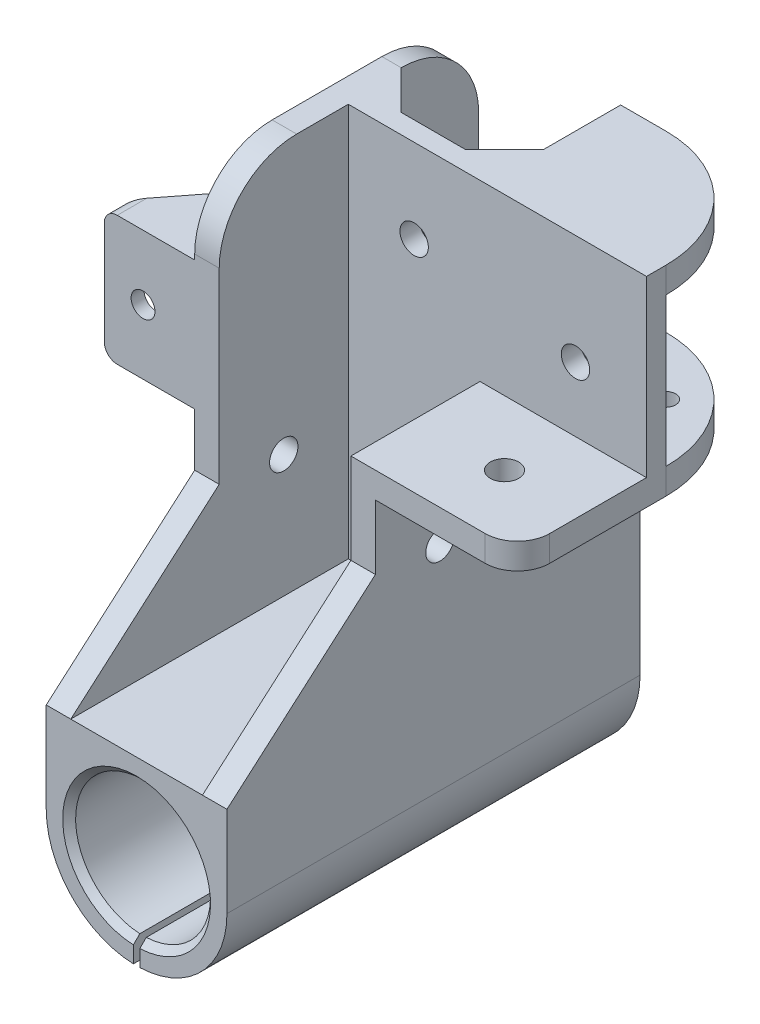
from build123d import *

# Parameters (mm, degrees)
BOSS_EXTRUDE1_DEPTH     = 64
CUT_EXTRUDE1_DEPTH      = 61
CUT_EXTRUDE2_DEPTH      = 103.493902258
CUT_EXTRUDE2_DEPTH_BACK = 103.493902258
CUT_EXTRUDE3_DEPTH      = 43
CUT_EXTRUDE4_DEPTH      = 105.961897849
CHAMFER1_SIZE           = 1
SKETCH6_R               = 2.2
CUT_EXTRUDE5_DEPTH      = 94.648278148
BOSS_EXTRUDE2_DEPTH     = 14
CUT_EXTRUDE6_DEPTH      = 106.81625079
SKETCH9_R               = 1.85
CUT_EXTRUDE7_DEPTH      = 93.746967605
FILLET1_R               = 2
FILLET2_R               = 12
SKETCH10_R              = 2.2
CUT_EXTRUDE8_DEPTH      = 108.168092266
FILLET3_R               = 5
FILLET4_START           = 44
FILLET4_DEPTH           = 31
SKETCH11_R              = 2.2
CUT_EXTRUDE9_DEPTH      = 97.098348533
SKETCH12_W              = 18
SKETCH12_H              = 23
CUT_EXTRUDE10_DEPTH     = 22
CUT_EXTRUDE11_REACH     = 95.568
SKETCH13_R              = 1.500000659
SKETCH13_R_2            = 1.499999352


with BuildPart() as part:
    # Sketch1 → Boss-Extrude1 (new body)
    with BuildSketch(Plane.XY):
        with BuildLine():
            Line((-14, 0), (-14, 75))
            Line((-14, 75), (36, 75))
            Line((36, 75), (36, 44))
            Line((36, 44), (14, 44))
            Line((14, 44), (14, 0))
            ThreePointArc((14, 0), (0, -14), (-14, 0))
        make_face()
    extrude(amount=BOSS_EXTRUDE1_DEPTH)

    # Sketch2 → Cut-Extrude1 (cut)
    with BuildSketch(Plane(origin=(0, 75, 0), x_dir=(1, 0, 0), z_dir=(0, 1, 0))):
        Polygon((-11, 0), (-11, -12), (-5, -18), (5, -18), (11, -12), (11, 0), align=None)
    extrude(amount=-CUT_EXTRUDE1_DEPTH, mode=Mode.SUBTRACT)

    # Sketch3 → Cut-Extrude2 (cut, two sides: drawn at the far end of the back side and taken through both)
    with BuildSketch(Plane(origin=(14, 0, 0), x_dir=(0, 0, -1), z_dir=(1, 0, 0)).offset(-CUT_EXTRUDE2_DEPTH_BACK)):
        Polygon((-64, 14), (-41, 34), (-41, 75), (-64, 75), align=None)
    extrude(amount=CUT_EXTRUDE2_DEPTH + CUT_EXTRUDE2_DEPTH_BACK, mode=Mode.SUBTRACT)

    # Sketch4 → Cut-Extrude3 (cut)
    with BuildSketch(Plane.XY.offset(64)):
        Polygon((-10.2, 14), (-10.2, 75), (36, 75), (36, 48), (10.2, 48), (10.2, 14), align=None)
    extrude(amount=-CUT_EXTRUDE3_DEPTH, mode=Mode.SUBTRACT)

    # Sketch5 → Cut-Extrude4 (cut, through all)
    with BuildSketch(Plane.XY.offset(64)):
        with BuildLine():
            Line((-0.5, -10.438031424), (-0.5, -13.99106858))
            ThreePointArc((-0.5, -13.99106858), (0, -14), (0.5, -13.99106858))
            Line((0.5, -13.99106858), (0.5, -10.438031424))
            ThreePointArc((0.5, -10.438031424), (0, 10.45), (-0.5, -10.438031424))
        make_face()
    extrude(amount=-CUT_EXTRUDE4_DEPTH, mode=Mode.SUBTRACT)

    # Chamfer1
    chamfer1_edges = [part.edges().sort_by_distance(p)[0] for p in [
        (0, 10.45, 0),
        (0, 10.45, 64),
    ]]
    chamfer(chamfer1_edges, length=CHAMFER1_SIZE)

    # Sketch6 → Cut-Extrude5 (cut, through all)
    with BuildSketch(Plane.XY.offset(21)):
        with Locations((0, 62)):
            Circle(SKETCH6_R)
        with Locations((0, 27)):
            Circle(SKETCH6_R)
        with Locations((25, 58)):
            Circle(SKETCH6_R)
    extrude(amount=-CUT_EXTRUDE5_DEPTH, mode=Mode.SUBTRACT)

    # Sketch7 → Boss-Extrude2 (add)
    with BuildSketch(Plane(origin=(-14, 0, 0), x_dir=(0, 0, -1), z_dir=(1, 0, 0))):
        Polygon((-41, 62.2), (-21, 62.2), (-21, 60.2), (-39, 60.2), (-39, 44.2), (-21, 44.2), (-21, 42.2), (-41, 42.2), align=None)
    extrude(amount=-BOSS_EXTRUDE2_DEPTH)

    # Sketch8 → Cut-Extrude6 (cut, through all)
    with BuildSketch(Plane(origin=(0, 62.2, 0), x_dir=(1, 0, 0), z_dir=(0, 1, 0))):
        Polygon((-14, -21), (-28, -39), (-28, -21), align=None)
    extrude(amount=-CUT_EXTRUDE6_DEPTH, mode=Mode.SUBTRACT)

    # Sketch9 → Cut-Extrude7 (cut, through all)
    with BuildSketch(Plane.XY.offset(41)):
        with Locations((-22, 52.2)):
            Circle(SKETCH9_R)
    extrude(amount=-CUT_EXTRUDE7_DEPTH, mode=Mode.SUBTRACT)

    # Fillet1
    fillet1_edges = [part.edges().sort_by_distance(p)[0] for p in [
        (-28, 42.2, 40),
        (-28, 62.2, 40),
    ]]
    fillet(fillet1_edges, radius=FILLET1_R)

    # Fillet2
    fillet2_edges = [part.edges().sort_by_distance(p)[0] for p in [
        (-12.5, 75, 0),
        (-12.1, 75, 41),
    ]]
    fillet(fillet2_edges, radius=FILLET2_R)

    # Sketch10 → Cut-Extrude8 (cut, through all)
    with BuildSketch(Plane(origin=(14, 0, 0), x_dir=(0, 0, -1), z_dir=(1, 0, 0))):
        with Locations(Location((-31, 33, 0), (0, 0, 90))):
            Circle(SKETCH10_R)
    extrude(amount=-CUT_EXTRUDE8_DEPTH, mode=Mode.SUBTRACT)

    # Fillet3
    fillet3_edges = [part.edges().sort_by_distance(p)[0] for p in [
        (36, 46, 41),
    ]]
    fillet(fillet3_edges, radius=FILLET3_R)

    # Fillet4: read off the stored shape, not the designer's step
    # Fillet4 outline → Fillet4 (cut)
    with BuildSketch(Plane(origin=(0, 0, 0), x_dir=(1, 0, 0), z_dir=(0, 1, 0)).offset(FILLET4_START)):
        with BuildLine():
            ThreePointArc((18, 0), (30.727922061, -5.272077939), (36, -18))
            Line((36, -18), (36, 0))
            Line((36, 0), (18, 0))
        make_face()
    extrude(amount=FILLET4_DEPTH, mode=Mode.SUBTRACT)

    # Sketch11 → Cut-Extrude9 (cut, through all)
    with BuildSketch(Plane(origin=(0, 48, 0), x_dir=(1, 0, 0), z_dir=(0, 1, 0))):
        with Locations(Location((24, -31, 0), (0, 0, 270))):
            Circle(SKETCH11_R)
    extrude(amount=-CUT_EXTRUDE9_DEPTH, mode=Mode.SUBTRACT)

    # Sketch12 → Cut-Extrude10 (cut)
    with BuildSketch(Plane.ZY.offset(-36)):
        with Locations((9, 59.5)):
            Rectangle(SKETCH12_W, SKETCH12_H)
    extrude(amount=CUT_EXTRUDE10_DEPTH, mode=Mode.SUBTRACT)

    # Sketch13 → Cut-Extrude11 (cut, up to next)
    with BuildSketch(Plane.XZ.offset(-44), mode=Mode.PRIVATE) as cut_extrude11_sk1:
        with Locations((19.000002521, 8.999996593)):
            Circle(SKETCH13_R)
    cut_extrude11_tool1 = extrude(cut_extrude11_sk1.sketch, amount=-CUT_EXTRUDE11_REACH, mode=Mode.PRIVATE) & part.part
    # Sketch13 → Cut-Extrude11 (cut, up to next)
    with BuildSketch(Plane.XZ.offset(-44), mode=Mode.PRIVATE) as cut_extrude11_sk2:
        with Locations((27.000001248, 8.999995496)):
            Circle(SKETCH13_R_2)
    cut_extrude11_tool2 = extrude(cut_extrude11_sk2.sketch, amount=-CUT_EXTRUDE11_REACH, mode=Mode.PRIVATE) & part.part
    add(cut_extrude11_tool1.solids().sort_by_distance((19.000003, 44, 8.999997))[0], mode=Mode.SUBTRACT)
    add(cut_extrude11_tool2.solids().sort_by_distance((27.000001, 44, 8.999995))[0], mode=Mode.SUBTRACT)


solid = part.part
